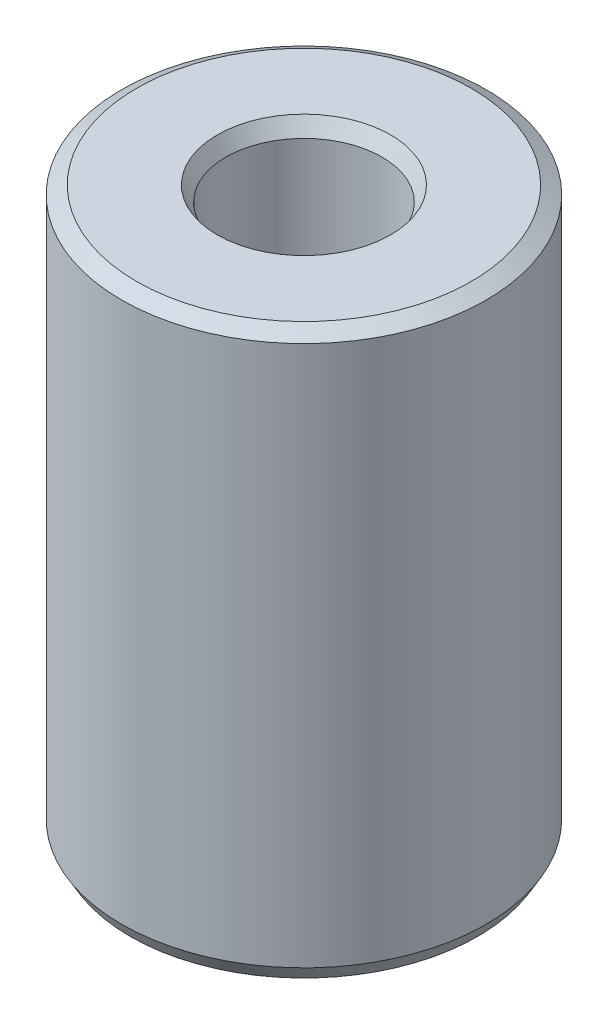
from build123d import *
from OCP.BRepFilletAPI import BRepFilletAPI_MakeChamfer

# Parameters (mm, degrees)
SKETCH1_R           = 27.5
BOSS_EXTRUDE1_DEPTH = 85.113434784
SKETCH2_R           = 11.778437482
CUT_EXTRUDE1_DEPTH  = 94.577757938
CHAMFER1_SIZE       = 1.298105988
CHAMFER1_SIZE2      = 2.248385525


with BuildPart() as part:
    # Sketch1 → Boss-Extrude1 (new body)
    with BuildSketch(Plane(origin=(0, 0, 0), x_dir=(1, 0, 0), z_dir=(0, 1, 0))):
        Circle(SKETCH1_R)
    extrude(amount=BOSS_EXTRUDE1_DEPTH)

    # Sketch2 → Cut-Extrude1 (cut, through all)
    with BuildSketch(Plane(origin=(0, 0, 0), x_dir=(1, 0, 0), z_dir=(0, 1, 0))):
        Circle(SKETCH2_R)
    extrude(amount=CUT_EXTRUDE1_DEPTH, mode=Mode.SUBTRACT)

    # Chamfer1: one chamfer whose edges measure the first distance from different faces: ONE call of the kernel's chamfer builder (chamfer() names one face for all edges)
    chamfer1_edges_1 = [part.edges().sort_by_distance(p)[0] for p in [
        (-11.778437482, 85.113434784, 0),
    ]]
    chamfer1_side_1 = [part.faces().sort_by_distance(p)[0] for p in [
        (-26.722182541, 85.113434784, 0),
    ]]
    chamfer1_edges_2 = [part.edges().sort_by_distance(p)[0] for p in [
        (-11.778437482, 0, 0),
    ]]
    chamfer1_side_2 = [part.faces().sort_by_distance(p)[0] for p in [
        (-11.778437482, 42.556717392, 0),
    ]]
    chamfer1_edges_3 = [part.edges().sort_by_distance(p)[0] for p in [
        (-27.5, 0, 0),
    ]]
    chamfer1_side_3 = [part.faces().sort_by_distance(p)[0] for p in [
        (-26.722182541, 0, 0),
    ]]
    chamfer1_edges_4 = [part.edges().sort_by_distance(p)[0] for p in [
        (-27.5, 85.113434784, 0),
    ]]
    chamfer1_side_4 = [part.faces().sort_by_distance(p)[0] for p in [
        (-27.5, 42.556717392, 0),
    ]]
    chamfer1 = BRepFilletAPI_MakeChamfer(part.part.solid().wrapped)
    for e in chamfer1_edges_1:
        chamfer1.Add(CHAMFER1_SIZE, CHAMFER1_SIZE2, e.wrapped, chamfer1_side_1[0].wrapped)  # the first distance lies on this face
    for e in chamfer1_edges_2:
        chamfer1.Add(CHAMFER1_SIZE, CHAMFER1_SIZE2, e.wrapped, chamfer1_side_2[0].wrapped)  # the first distance lies on this face
    for e in chamfer1_edges_3:
        chamfer1.Add(CHAMFER1_SIZE, CHAMFER1_SIZE2, e.wrapped, chamfer1_side_3[0].wrapped)  # the first distance lies on this face
    for e in chamfer1_edges_4:
        chamfer1.Add(CHAMFER1_SIZE, CHAMFER1_SIZE2, e.wrapped, chamfer1_side_4[0].wrapped)  # the first distance lies on this face
    add(Compound.cast(chamfer1.Shape()), mode=Mode.REPLACE)


solid = part.part
